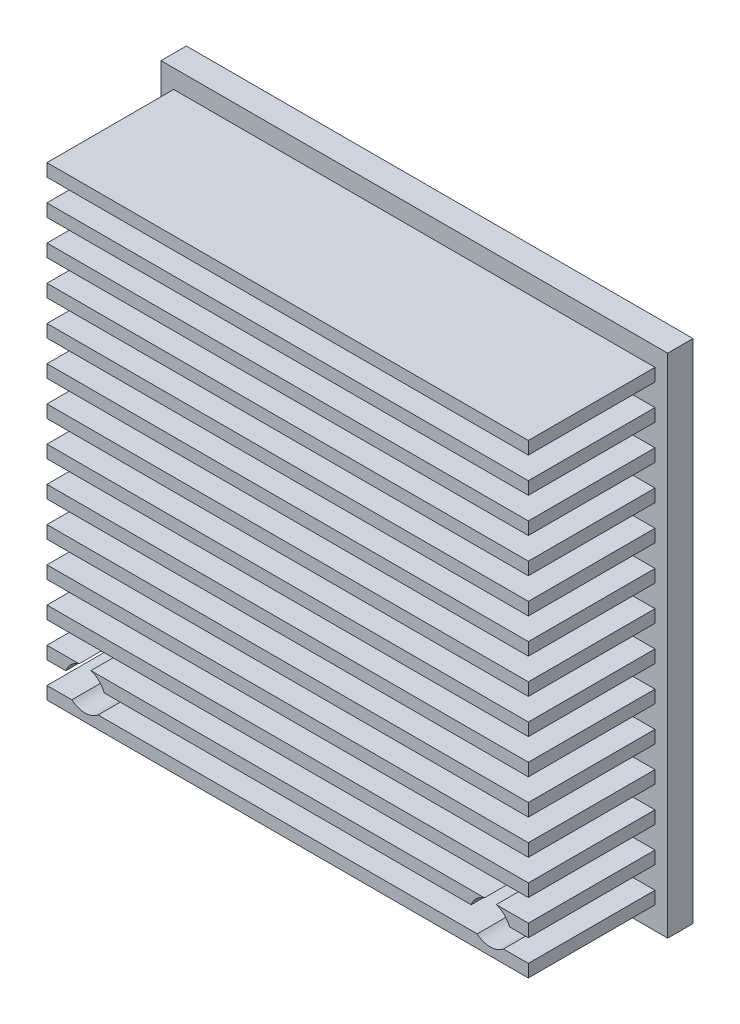
from build123d import *

# Parameters (mm, degrees)
SKETCH1_W           = 40
SKETCH1_H           = 40
BOSS_EXTRUDE1_DEPTH = 2
SKETCH2_W           = 38
SKETCH2_H           = 1
BOSS_EXTRUDE2_DEPTH = 10
SKETCH3_R           = 1.6
CUT_EXTRUDE1_DEPTH  = 31.724582991


with BuildPart() as part:
    # Sketch1 → Boss-Extrude1 (new body)
    with BuildSketch(Plane.XY):
        Rectangle(SKETCH1_W, SKETCH1_H)
    extrude(amount=BOSS_EXTRUDE1_DEPTH)

    # Sketch2 → Boss-Extrude2 (add)
    with BuildSketch(Plane.XY.offset(2)):
        with Locations((0, 15.280666702)):
            Rectangle(SKETCH2_W, SKETCH2_H)
        with Locations((0, 18.030666702)):
            Rectangle(SKETCH2_W, SKETCH2_H)
        with Locations((0, 12.530666702)):
            Rectangle(SKETCH2_W, SKETCH2_H)
        with Locations((0, 9.780666702)):
            Rectangle(SKETCH2_W, SKETCH2_H)
        with Locations((0, 7.030666702)):
            Rectangle(SKETCH2_W, SKETCH2_H)
        with Locations((0, 4.280666702)):
            Rectangle(SKETCH2_W, SKETCH2_H)
        with Locations((0, 1.530666702)):
            Rectangle(SKETCH2_W, SKETCH2_H)
        with Locations((0, -1.219333298)):
            Rectangle(SKETCH2_W, SKETCH2_H)
        with Locations((0, -3.969333298)):
            Rectangle(SKETCH2_W, SKETCH2_H)
        with Locations((0, -6.719333298)):
            Rectangle(SKETCH2_W, SKETCH2_H)
        with Locations((0, -9.469333298)):
            Rectangle(SKETCH2_W, SKETCH2_H)
        with Locations((0, -12.219333298)):
            Rectangle(SKETCH2_W, SKETCH2_H)
        with Locations((0, -14.969333298)):
            Rectangle(SKETCH2_W, SKETCH2_H)
        with Locations((0, -17.719333298)):
            Rectangle(SKETCH2_W, SKETCH2_H)
    extrude(amount=BOSS_EXTRUDE2_DEPTH)

    # Sketch3 → Cut-Extrude1 (cut, through all)
    with BuildSketch(Plane(origin=(0, 0, 0), x_dir=(-1, 0, 0), z_dir=(0, 0, -1))):
        with Locations((16, -16)):
            Circle(SKETCH3_R)
        with Locations((-16, -16)):
            Circle(SKETCH3_R)
    extrude(amount=-CUT_EXTRUDE1_DEPTH, mode=Mode.SUBTRACT)


solid = part.part
